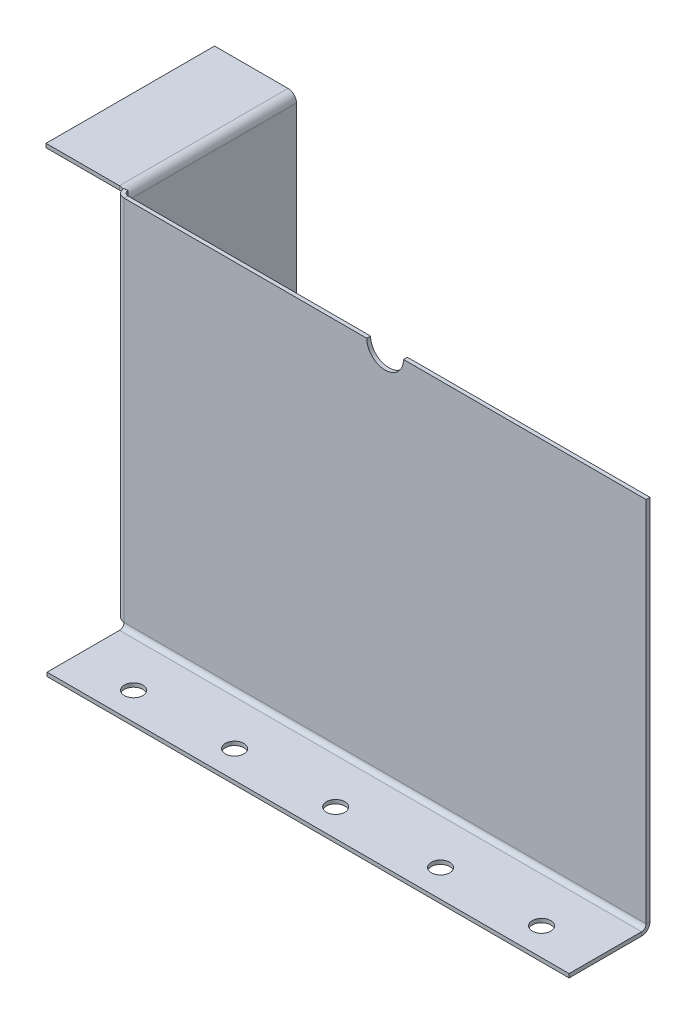
from build123d import *

# Parameters (mm, degrees)
BASE_FLANGE1_DEPTH           = 2.65684
SKETCHED_BEND3_DEPTH         = 360.91368
SKETCHED_BEND3_2_DEPTH       = 360.91368
SKETCH10_R                   = 6.35
CUT_EXTRUDE2_DEPTH           = 2.65684
EDGE_FLANGE5_DEPTH           = 254
EDGE_FLANGE6_STRIP_W         = 16.97736
EDGE_FLANGE6_STRIP_H         = 2.65684
EDGE_FLANGE6_STRIP_CUT_DEPTH = 116.5225
EDGE_FLANGE6_DEPTH           = 116.5225
SKETCH36_R                   = 6.35
CUT_EXTRUDE3_DEPTH           = 2.65684


# Read off the part's stored shape, not the designer's step: Sketched Bend3
# Sheet-metal steps are written as plain solids
with BuildPart() as part:
    # Sketch1 → Base-Flange1 (new body)
    with BuildSketch(Plane.XY):
        with BuildLine():
            Line((0, 0), (0, 254))
            Line((0, 254), (167.75684, 254))
            ThreePointArc((167.75684, 254), (180.45684, 241.3), (193.15684, 254))
            Line((193.15684, 254), (360.91368, 254))
            Line((360.91368, 254), (360.91368, 0))
            Line((360.91368, 0), (360.91368, -57.15))
            Line((360.91368, -57.15), (0, -57.15))
            Line((0, -57.15), (0, 0))
        make_face()
    extrude(amount=-BASE_FLANGE1_DEPTH)

    # Sketched Bend3 outline → Sketched Bend3 (cut)
    with BuildSketch(Plane.YZ):
        with BuildLine():
            ThreePointArc((0, -2.65684), (-2.783367186, -1.949765838), (-4.891802611, 0))
            Line((-4.891802611, 0), (-57.15, 0))
            Line((-57.15, 0), (-57.15, -2.65684))
            Line((-57.15, -2.65684), (0, -2.65684))
        make_face()
    extrude(amount=SKETCHED_BEND3_DEPTH, mode=Mode.SUBTRACT)

    # Sketched Bend3 2 outline → Sketched Bend3 2 (add)
    with BuildSketch(Plane.YZ):
        with BuildLine():
            ThreePointArc((0, 0), (-2.24506403, 0.92993597), (-3.175, 3.175))
            Line((-3.175, 3.175), (-3.175, 53.251044406))
            Line((-3.175, 53.251044406), (-5.83184, 53.251044406))
            Line((-5.83184, 53.251044406), (-5.83184, 3.175))
            ThreePointArc((-5.83184, 3.175), (-5.591894488, 1.519381136), (-4.891802611, 0))
            Line((-4.891802611, 0), (0, 0))
        make_face()
    extrude(amount=SKETCHED_BEND3_2_DEPTH)

    # Sketch10 → Cut-Extrude2 (cut)
    with BuildSketch(Plane(origin=(0, -3.175, 0), x_dir=(1, 0, 0), z_dir=(0, 1, 0))):
        with Locations(Location((322.81368, -34.201044406, 0), (0, 0, 270))):
            Circle(SKETCH10_R)
        with Locations(Location((252.96368, -34.201044406, 0), (0, 0, 270))):
            Circle(SKETCH10_R)
        with Locations(Location((40.75684, -34.201044406, 0), (0, 0, 270))):
            Circle(SKETCH10_R)
        with Locations(Location((110.60684, -34.201044406, 0), (0, 0, 270))):
            Circle(SKETCH10_R)
        with Locations(Location((180.45684, -34.201044406, 0), (0, 0, 270))):
            Circle(SKETCH10_R)
    extrude(amount=-CUT_EXTRUDE2_DEPTH, mode=Mode.SUBTRACT)

    # Edge-Flange5 section (across the edge) → Edge-Flange5 (add)
    with BuildSketch(Plane(origin=(-3.175, 0, -2.65684), x_dir=(1, 0, 0), z_dir=(0, 1, 0))):
        with BuildLine():
            Line((-2.65684, 3.175), (-2.65684, 119.6975))
            Line((-2.65684, 119.6975), (0, 119.6975))
            Line((0, 119.6975), (0, 3.175))
            ThreePointArc((0, 3.175), (0.92993597, 0.92993597), (3.175, 0))
            Line((3.175, 0), (3.175, -2.65684))
            ThreePointArc((3.175, -2.65684), (-0.948733611, -0.948733611), (-2.65684, 3.175))
        make_face()
    extrude(amount=EDGE_FLANGE5_DEPTH)

    # Edge-Flange6 strip (across the edge) → Edge-Flange6 strip cut (cut)
    with BuildSketch(Plane(origin=(-5.83184, 254, -5.83184), x_dir=(0, -1, 0), z_dir=(0, 0, -1))):
        with Locations((-2.65684, -1.32842)):
            Rectangle(EDGE_FLANGE6_STRIP_W, EDGE_FLANGE6_STRIP_H)
    extrude(amount=EDGE_FLANGE6_STRIP_CUT_DEPTH, mode=Mode.SUBTRACT)

    # Edge-Flange6 section (across the edge) → Edge-Flange6 (add)
    with BuildSketch(Plane(origin=(-5.83184, 254, -5.83184), x_dir=(0, -1, 0), z_dir=(0, 0, -1))):
        with BuildLine():
            Line((0, 3.175), (0, 53.975))
            Line((0, 53.975), (2.65684, 53.975))
            Line((2.65684, 53.975), (2.65684, 3.175))
            ThreePointArc((2.65684, 3.175), (3.58677597, 0.92993597), (5.83184, 0))
            Line((5.83184, 0), (5.83184, -2.65684))
            ThreePointArc((5.83184, -2.65684), (1.708106389, -0.948733611), (0, 3.175))
        make_face()
    extrude(amount=EDGE_FLANGE6_DEPTH)

    # Sketch36 → Cut-Extrude3 (cut)
    with BuildSketch(Plane.ZY.offset(5.83184)):
        with Locations((-32.886251514, 45.966665125)):
            Circle(SKETCH36_R)
        with Locations((-89.021589499, 43.324159587)):
            Circle(SKETCH36_R)
    extrude(amount=-CUT_EXTRUDE3_DEPTH, mode=Mode.SUBTRACT)


solid = part.part
